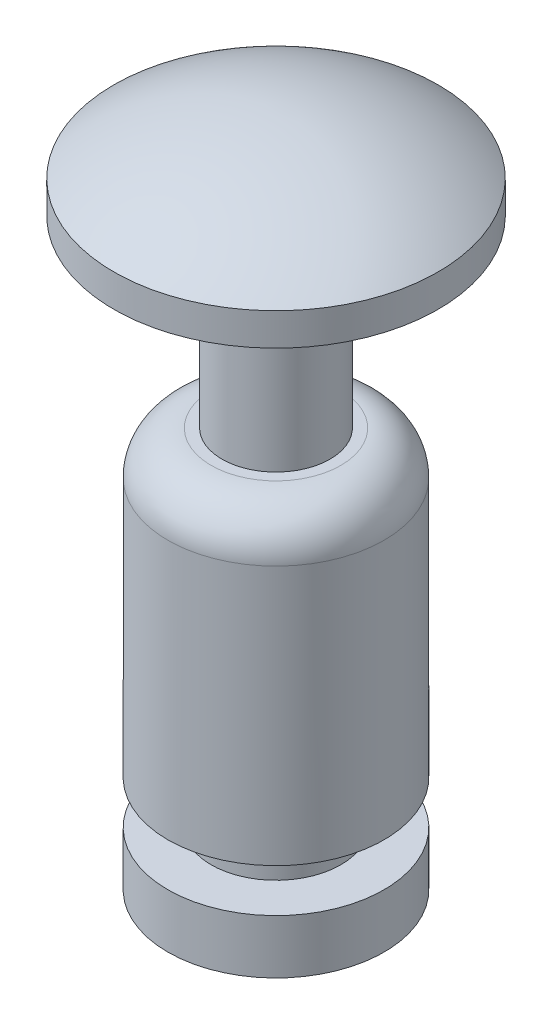
from build123d import *

# Parameters (mm, degrees)
SKETCH2_R           = 1.5
BOSS_EXTRUDE1_DEPTH = 6.2
SKETCH5_OUTSIDE_W   = 6.502
SKETCH5_OUTSIDE_H   = 6.502
SKETCH5_OUTSIDE_R   = 1
CUT_EXTRUDE1_DEPTH  = 5.4
SKETCH4_W           = 0.4
SKETCH4_H           = 0.4
SKETCH4_W_2         = 0.5
SKETCH4_H_2         = 1.7
FILLET1_R           = 0.4


with BuildPart() as part:
    # Sketch2 → Boss-Extrude1 (new body)
    with BuildSketch(Plane(origin=(0, 0, 0), x_dir=(1, 0, 0), z_dir=(0, 1, 0))):
        Circle(SKETCH2_R)
    extrude(amount=BOSS_EXTRUDE1_DEPTH)

    # Sketch3 → Cut-Revolve1 (revolve, cut)
    with BuildSketch(Plane.XY):
        with BuildLine():
            Line((0, 6.2), (0, 6.3))
            Line((0, 6.3), (1.5, 6.3))
            Line((1.5, 6.3), (1.5, 5.7))
            ThreePointArc((1.5, 5.7), (0.790569415, 6.071708245), (0, 6.2))
        make_face()
    revolve(axis=Axis((0, 6.2, 0), (0, -1, 0)), mode=Mode.SUBTRACT)

    # Sketch5 outside → Cut-Extrude1 (cut)
    with BuildSketch(Plane.XZ):
        Rectangle(SKETCH5_OUTSIDE_W, SKETCH5_OUTSIDE_H)
        Circle(SKETCH5_OUTSIDE_R, mode=Mode.SUBTRACT)
    extrude(amount=-CUT_EXTRUDE1_DEPTH, mode=Mode.SUBTRACT)

    # Sketch4 → Cut-Revolve2 (revolve, cut)
    with BuildSketch(Plane.XY):
        with Locations((0.8, 0.7)):
            Rectangle(SKETCH4_W, SKETCH4_H)
        with Locations((0.75, 4.55)):
            Rectangle(SKETCH4_W_2, SKETCH4_H_2)
    revolve(axis=Axis((0, 0, 0), (0, 1, 0)), mode=Mode.SUBTRACT)

    # Fillet1
    fillet1_edges = [part.edges().sort_by_distance(p)[0] for p in [
        (-1, 3.7, 0),
    ]]
    fillet(fillet1_edges, radius=FILLET1_R)


solid = part.part
